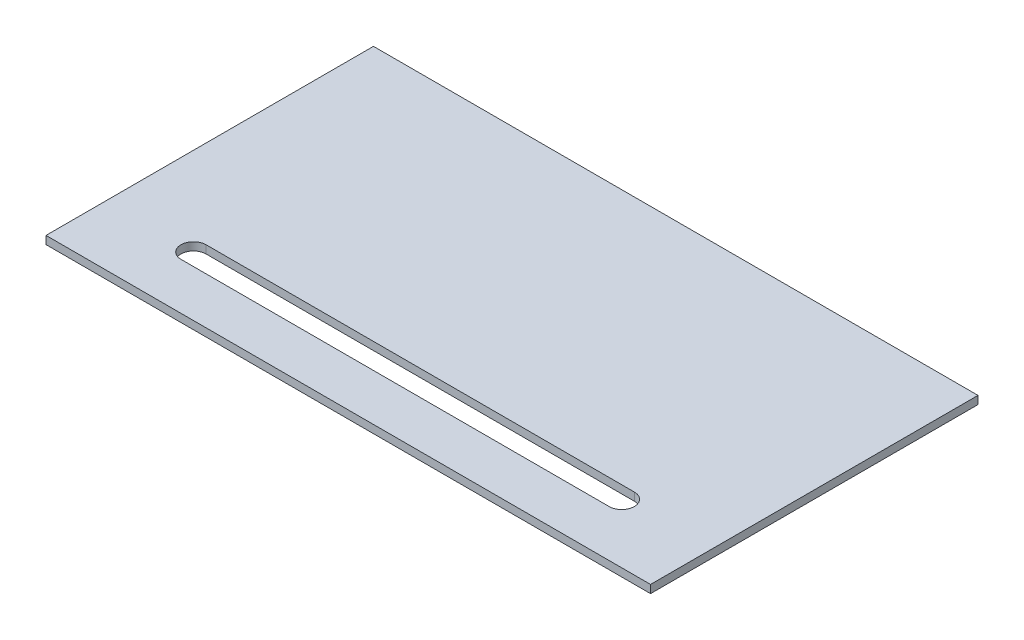
from build123d import *

# Parameters (mm, degrees)
SKETCH1_W           = 240
SKETCH1_H           = 130
BOSS_EXTRUDE4_DEPTH = 3.175


with BuildPart() as part:
    # Sketch1 → Boss-Extrude4 (new body)
    with BuildSketch(Plane(origin=(0, 0, 0), x_dir=(1, 0, 0), z_dir=(0, 1, 0))):
        Rectangle(SKETCH1_W, SKETCH1_H)
        with BuildLine():
            ThreePointArc((-85, -46.438117734), (-90, -41.438117734), (-85, -36.438117734))
            Line((-85, -36.438117734), (85, -36.438117734))
            ThreePointArc((85, -36.438117734), (90, -41.438117734), (85, -46.438117734))
            Line((85, -46.438117734), (-85, -46.438117734))
        make_face(mode=Mode.SUBTRACT)
    extrude(amount=BOSS_EXTRUDE4_DEPTH)


solid = part.part
